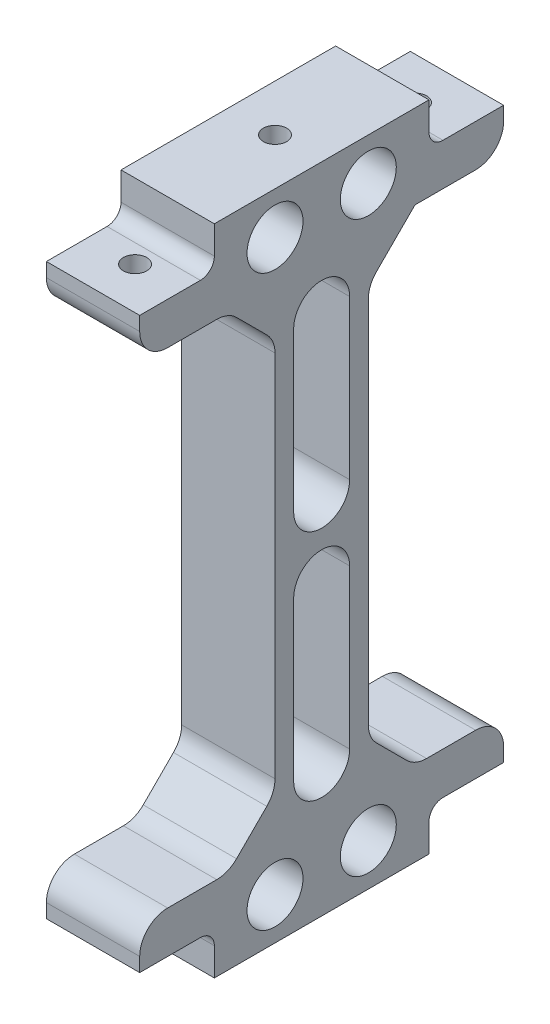
from build123d import *

# Parameters (mm, degrees)
SKETCH1_R             = 3
BOSS_EXTRUDE1_DEPTH   = 10
CHAMFER1_SIZE         = 5
FILLET1_R             = 3
SKETCH4_W             = 8
SKETCH4_H             = 4.5
CUT_EXTRUDE1_DEPTH    = 10
FILLET2_R             = 1.5
M3_TAPPED_HOLE1_D     = 2.5
M3_TAPPED_HOLE1_DEPTH = 17.5
M3_TAPPED_HOLE1_TIP   = 0.751075774
M3_TAPPED_HOLE2_D     = 2.5
M3_TAPPED_HOLE2_DEPTH = 7.5
M3_TAPPED_HOLE2_TIP   = 0.751075774


with BuildPart() as part:
    # Sketch1 → Boss-Extrude1 (new body)
    with BuildSketch(Plane(origin=(0, 0, 0), x_dir=(0, 0, -1), z_dir=(1, 0, 0))):
        Polygon((-10, 4.5), (-24.5, 4.5), (-24.5, -4.5), (14.5, -4.5), (14.5, 4.5), (0, 4.5), (0, 56.5), (14.5, 56.5), (14.5, 65.5), (-24.5, 65.5), (-24.5, 56.5), (-10, 56.5), align=None)
        with BuildLine():
            ThreePointArc((-8, 26.5), (-5, 29.5), (-2, 26.5))
            Line((-2, 26.5), (-2, 9.5))
            ThreePointArc((-2, 9.5), (-5, 6.5), (-8, 9.5))
            Line((-8, 9.5), (-8, 26.5))
        make_face(mode=Mode.SUBTRACT)
        with BuildLine():
            Line((-2, 51.5), (-2, 34.5))
            ThreePointArc((-2, 34.5), (-5, 31.5), (-8, 34.5))
            Line((-8, 34.5), (-8, 51.5))
            ThreePointArc((-8, 51.5), (-5, 54.5), (-2, 51.5))
        make_face(mode=Mode.SUBTRACT)
        with Locations((-10, 0)):
            Circle(SKETCH1_R, mode=Mode.SUBTRACT)
        Circle(SKETCH1_R, mode=Mode.SUBTRACT)
        with Locations((-10, 61)):
            Circle(SKETCH1_R, mode=Mode.SUBTRACT)
        with Locations((0, 61)):
            Circle(SKETCH1_R, mode=Mode.SUBTRACT)
    extrude(amount=BOSS_EXTRUDE1_DEPTH)

    # Chamfer1
    chamfer1_edges = [part.edges().sort_by_distance(p)[0] for p in [
        (5, 56.5, 10),
        (5, 56.5, 0),
        (5, 4.5, 0),
        (5, 4.5, 10),
    ]]
    chamfer(chamfer1_edges, length=CHAMFER1_SIZE)

    # Fillet1
    fillet1_edges = [part.edges().sort_by_distance(p)[0] for p in [
        (5, 51.5, 0),
        (5, 9.5, 0),
        (5, 9.5, 10),
        (5, 51.5, 10),
        (5, 56.5, 15),
        (5, 56.5, 24.5),
        (5, 65.5, 24.5),
        (5, 65.5, -14.5),
        (5, 56.5, -14.5),
        (5, 4.5, -5),
        (5, 4.5, -14.5),
        (5, -4.5, -14.5),
        (5, -4.5, 24.5),
        (5, 4.5, 24.5),
        (5, 4.5, 15),
    ]]
    fillet(fillet1_edges, radius=FILLET1_R)

    # Sketch4 → Cut-Extrude1 (cut)
    with BuildSketch(Plane(origin=(10, 0, 0), x_dir=(0, 0, -1), z_dir=(1, 0, 0))):
        with Locations((-20.5, 63.25)):
            Rectangle(SKETCH4_W, SKETCH4_H)
        with Locations((10.5, 63.25)):
            Rectangle(SKETCH4_W, SKETCH4_H)
        with Locations((10.5, -2.25)):
            Rectangle(SKETCH4_W, SKETCH4_H)
        with Locations((-20.5, -2.25)):
            Rectangle(SKETCH4_W, SKETCH4_H)
    extrude(amount=-CUT_EXTRUDE1_DEPTH, mode=Mode.SUBTRACT)

    # Fillet2
    fillet2_edges = [part.edges().sort_by_distance(p)[0] for p in [
        (5, 0, 16.5),
        (5, 0, -6.5),
        (5, 61, -6.5),
        (5, 61, 16.5),
    ]]
    fillet(fillet2_edges, radius=FILLET2_R)

    # M3 Tapped Hole1
    with Locations(Plane(origin=(0, 61, 0), x_dir=(1, 0, 0), z_dir=(0, 1, 0))):
        with Locations((5, -20), (5, 10)):
            Hole(M3_TAPPED_HOLE1_D / 2, depth=M3_TAPPED_HOLE1_DEPTH)
            with Locations((0, 0, -(M3_TAPPED_HOLE1_DEPTH + M3_TAPPED_HOLE1_TIP / 2))):  # 118° drill point
                Cone(0, M3_TAPPED_HOLE1_D / 2, M3_TAPPED_HOLE1_TIP, mode=Mode.SUBTRACT)

    # M3 Tapped Hole2
    with Locations(Plane(origin=(0, 65.5, 0), x_dir=(1, 0, 0), z_dir=(0, 1, 0))):
        with Locations((5, -5)):
            Hole(M3_TAPPED_HOLE2_D / 2, depth=M3_TAPPED_HOLE2_DEPTH)
            with Locations((0, 0, -(M3_TAPPED_HOLE2_DEPTH + M3_TAPPED_HOLE2_TIP / 2))):  # 118° drill point
                Cone(0, M3_TAPPED_HOLE2_D / 2, M3_TAPPED_HOLE2_TIP, mode=Mode.SUBTRACT)


solid = part.part
